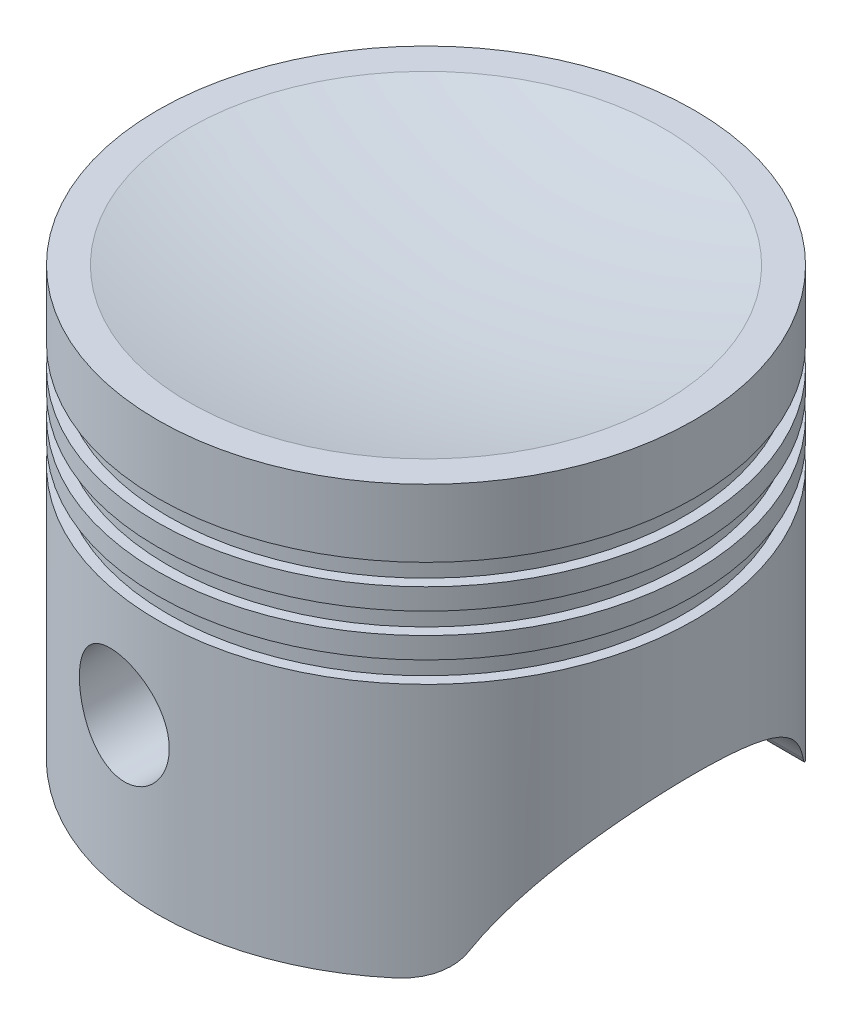
from build123d import *

# Parameters (mm, degrees)
SKETCH2_W                = 2.5
SKETCH2_H                = 5
LPATTERN1_COUNT          = 3
LPATTERN1_PITCH          = 10
CUT_EXTRUDE1_DEPTH       = 118.194667114
CUT_EXTRUDE1_DEPTH_BACK  = 118.194667114
SKETCH3_R                = 12.7
CUT_EXTRUDE3_DEPTH       = 118.194667287
CUT_EXTRUDE3_DEPTH_BACK  = 118.194667287
FILLET1_R                = 10
BOSS_EXTRUDE1_REACH      = 149.195
BOSS_EXTRUDE1_END_RADIUS = 57.15
BOSS_EXTRUDE1_START      = 30
SKETCH5_R                = 15.2
SKETCH5_R_2              = 12.7


with BuildPart() as part:
    # Sketch1 → Revolve1 (revolve)
    with BuildSketch(Plane.XY, mode=Mode.PRIVATE) as revolve1_sk:
        with BuildLine():
            Line((0, 19), (0, 0))
            Line((0, 0), (57.15, 0))
            Line((57.15, 0), (57.15, -75.3))
            Line((57.15, -75.3), (63.5, -75.3))
            Line((63.5, -75.3), (63.5, 26))
            Line((63.5, 26), (56.15, 26))
            ThreePointArc((56.15, 26), (28.278100119, 20.870846903), (0, 19))
        make_face()
    revolve(revolve1_sk.sketch.rotate(Axis((0, 19, 0), (0, -1, 0)), 180), axis=Axis((0, 19, 0), (0, -1, 0)))

    # Sketch2 → Cut-Revolve1 (revolve, cut)
    with BuildSketch(Plane.XY, mode=Mode.PRIVATE) as cut_revolve1_sk:
        with Locations((62.25, 7.5)):
            Rectangle(SKETCH2_W, SKETCH2_H)
    cut_revolve1 = revolve(cut_revolve1_sk.sketch.rotate(Axis((0, 0, 0), (0, 1, 0)), 180), axis=Axis((0, 0, 0), (0, 1, 0)), mode=Mode.SUBTRACT)

    # LPattern1: Cut-Revolve1 ×3
    with Locations(*[(0, -i * LPATTERN1_PITCH, 0) for i in range(1, LPATTERN1_COUNT)]):
        add(cut_revolve1, mode=Mode.SUBTRACT)

    # Sketch3 → Cut-Extrude1 (cut, two sides: drawn at the far end of the back side and taken through both)
    with BuildSketch(Plane.XY.offset(-CUT_EXTRUDE1_DEPTH_BACK)):
        with Locations((-10, -40)):
            Circle(SKETCH3_R)
    extrude(amount=CUT_EXTRUDE1_DEPTH + CUT_EXTRUDE1_DEPTH_BACK, mode=Mode.SUBTRACT)

    # Sketch4 → Cut-Extrude3 (cut, two sides: drawn at the far end of the back side and taken through both)
    with BuildSketch(Plane(origin=(0, 0, 0), x_dir=(0, 0, -1), z_dir=(1, 0, 0)).offset(-CUT_EXTRUDE3_DEPTH_BACK)):
        with BuildLine():
            Line((-150.607887092, -357.651696512), (-42, -75.3))
            ThreePointArc((-42, -75.3), (0, -46.455494421), (42, -75.3))
            Line((42, -75.3), (150.607887092, -357.651696512))
            Line((150.607887092, -357.651696512), (150.607887092, -962.691046182))
            Line((150.607887092, -962.691046182), (-150.607887092, -962.691046182))
            Line((-150.607887092, -962.691046182), (-150.607887092, -357.651696512))
        make_face()
    extrude(amount=CUT_EXTRUDE3_DEPTH + CUT_EXTRUDE3_DEPTH_BACK, mode=Mode.SUBTRACT)

    # Fillet1
    # the kernel refuses this fillet: 10 mm, written as the material it takes off along each edge
    with BuildSketch(Plane(origin=(63.583013308, -75.3, 42), x_dir=(0, 0.9083807758809636, -0.41814395369286256), z_dir=(-1, 0, 0)), Plane(origin=(-22.800360105, -75.3, 42), x_dir=(0, 0.9083807758809636, -0.41814395369286256), z_dir=(-1, 0, 0))) as fillet1_piece_1:
        with BuildLine():
            CenterArc((6.414901106, -9.979403311), FILLET1_R, 93.67799309, 61.604544038)
            Line((-2.668906652, -5.797963774), (0, 0))
            ThreePointArc((0, 0), (2.886705498, -0.092685102), (5.773410996, 0))
        make_face()
    extrude(amount=40.782653203, mode=Mode.SUBTRACT)
    with BuildSketch(Plane(origin=(63.583013308, -75.3, -42), x_dir=(0, 0, -1), z_dir=(-1, 0, 0))) as fillet1_piece_2:
        with BuildLine():
            CenterArc((6.382746011, -10), FILLET1_R, 90, 61.604544038)
            ThreePointArc((-2.4141169, -5.24445556), (-1.122865085, -2.660983495), (0, 0))
            Line((0, 0), (6.382746011, 0))
        make_face()
    extrude(amount=40.782653203, mode=Mode.SUBTRACT)
    with BuildSketch(Plane(origin=(-22.800360105, -75.3, -42), x_dir=(0, 0.9083807758809641, 0.4181439536928614), z_dir=(-1, 0, 0))) as fillet1_piece_3:
        with BuildLine():
            CenterArc((6.414901106, 9.979403311), FILLET1_R, 204.717462871, 61.604544038)
            Line((-2.668906652, 5.797963774), (0, 0))
            ThreePointArc((0, 0), (2.886705498, 0.092685102), (5.773410996, 0))
        make_face()
    extrude(amount=40.782653203, mode=Mode.SUBTRACT)

    # Boss-Extrude1: up to this cylinder (the profile starts inside it)
    boss_extrude1_end = Plane(origin=(0, -40, 0), z_dir=(0, 1, 0)) * Cylinder(BOSS_EXTRUDE1_END_RADIUS, 413.69, mode=Mode.PRIVATE)
    # Sketch5 → Boss-Extrude1 (add, up to the surface)
    with BuildSketch(Plane.XY.offset(BOSS_EXTRUDE1_START), mode=Mode.PRIVATE) as boss_extrude1_sk1:
        with Locations(Location((-10, -40, 0), (0, 0, 180))):
            Circle(SKETCH5_R)
        with Locations((-10, -40)):
            Circle(SKETCH5_R_2, mode=Mode.SUBTRACT)
    boss_extrude1_tool1 = extrude(boss_extrude1_sk1.sketch, amount=BOSS_EXTRUDE1_REACH, mode=Mode.PRIVATE) & boss_extrude1_end
    boss_extrude1 = boss_extrude1_tool1.solids().sort_by_distance((4.770079, -40, 30))[0]
    add(boss_extrude1)

    # Mirror1: Boss-Extrude1 across plane
    add(boss_extrude1.mirror(Plane.XY))


solid = part.part
